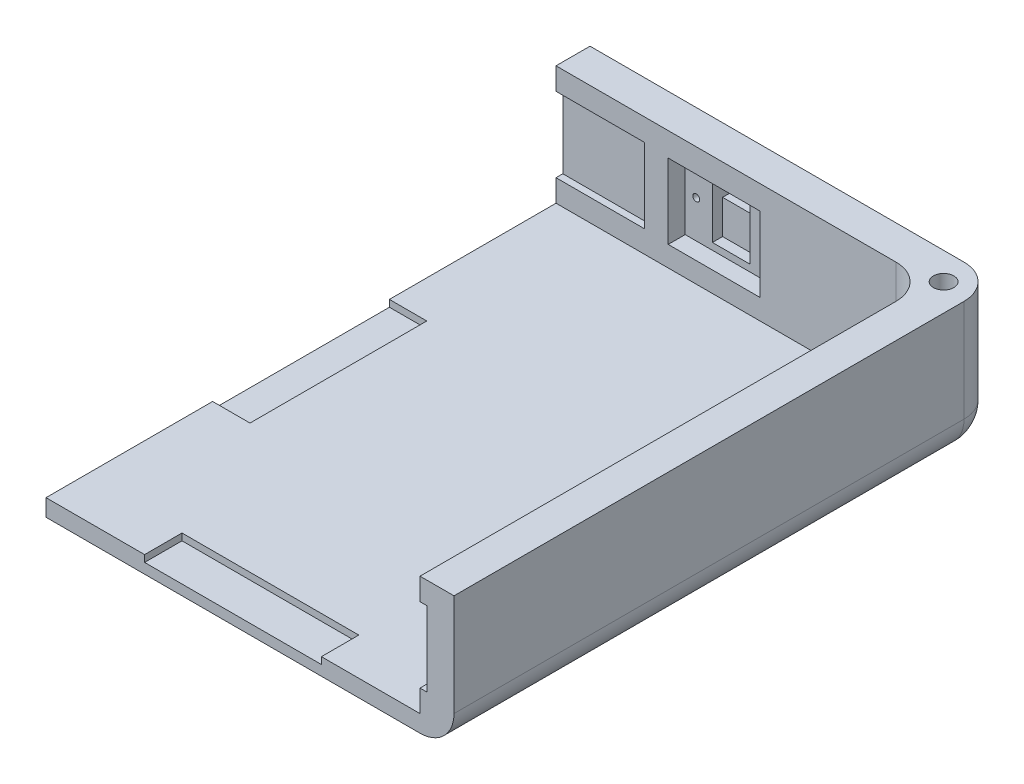
from build123d import *

# Parameters (mm, degrees)
ESQUISSE1_W             = 120
ESQUISSE1_H             = 160
BOSS_EXTRU_1_DEPTH      = 40
CONG_1_R                = 10
CONG_2_R                = 10
ESQUISSE2_W             = 110
ESQUISSE2_H             = 150
ENL_V_MAT_EXTRU_1_DEPTH = 35
CONG_3_R                = 10
ESQUISSE3_R             = 3
ENL_V_MAT_EXTRU_2_DEPTH = 35
ESQUISSE4_R             = 2.5
BOSS_EXTRU_2_DEPTH      = 2.5
CONG_4_R                = 2.5
ESQUISSE5_W             = 11
ESQUISSE5_H             = 52
ESQUISSE5_W_2           = 52
ESQUISSE5_H_2           = 11
ENL_V_MAT_EXTRU_3_DEPTH = 2
ESQUISSE6_W             = 26
ESQUISSE6_H             = 22
ENL_V_MAT_EXTRU_4_DEPTH = 2
ESQUISSE7_W             = 26
ESQUISSE7_H             = 22
ENL_V_MAT_EXTRU_5_DEPTH = 2
ESQUISSE8_W             = 27
ESQUISSE8_H             = 22
ENL_V_MAT_EXTRU_6_DEPTH = 5
ESQUISSE9_R             = 1
ENL_V_MAT_EXTRU_7_DEPTH = 4
ESQUISSE10_W            = 11
ESQUISSE10_H            = 6
ENL_V_MAT_EXTRU_8_DEPTH = 201.062490237
ESQUISSE11_W            = 11
ESQUISSE11_H            = 10
ENL_V_MAT_EXTRU_9_DEPTH = 3


with BuildPart() as part:
    # Esquisse1 → Boss.-Extru.1 (new body)
    with BuildSketch(Plane(origin=(0, 0, 0), x_dir=(1, 0, 0), z_dir=(0, 1, 0))):
        with Locations((60, 80)):
            Rectangle(ESQUISSE1_W, ESQUISSE1_H)
    extrude(amount=BOSS_EXTRU_1_DEPTH)

    # Congé1
    cong_1_edges = [part.edges().sort_by_distance(p)[0] for p in [
        (60, 0, -160),
    ]]
    fillet(cong_1_edges, radius=CONG_1_R)

    # Congé2
    cong_2_edges = [part.edges().sort_by_distance(p)[0] for p in [
        (120, 2.928932188, -157.071067812),
        (120, 0, -75),
        (120, 25, -160),
    ]]
    fillet(cong_2_edges, radius=CONG_2_R)

    # Esquisse2 → Enlèv. mat.-Extru.1 (cut)
    with BuildSketch(Plane(origin=(0, 40, 0), x_dir=(1, 0, 0), z_dir=(0, 1, 0))):
        with Locations((55, 75)):
            Rectangle(ESQUISSE2_W, ESQUISSE2_H)
    extrude(amount=-ENL_V_MAT_EXTRU_1_DEPTH, mode=Mode.SUBTRACT)

    # Congé3
    cong_3_edges = [part.edges().sort_by_distance(p)[0] for p in [
        (110, 22.5, -150),
    ]]
    fillet(cong_3_edges, radius=CONG_3_R)

    # Esquisse3 → Enlèv. mat.-Extru.2 (cut)
    with BuildSketch(Plane(origin=(0, 40, 0), x_dir=(1, 0, 0), z_dir=(0, 1, 0))):
        with Locations(Location((112, 152, 0), (0, 0, 270))):
            Circle(ESQUISSE3_R)
    extrude(amount=-ENL_V_MAT_EXTRU_2_DEPTH, mode=Mode.SUBTRACT)

    # Esquisse4 → Boss.-Extru.2 (add)
    with BuildSketch(Plane.XZ):
        with Locations(Location((90, -130, 0), (0, 0, 270))):
            Circle(ESQUISSE4_R)
    extrude(amount=BOSS_EXTRU_2_DEPTH)

    # Congé4
    cong_4_edges = [part.edges().sort_by_distance(p)[0] for p in [
        (90, -2.5, -127.5),
    ]]
    fillet(cong_4_edges, radius=CONG_4_R - 0.0001)  # a hair under: the kernel refuses the full size

    # Esquisse5 → Enlèv. mat.-Extru.3 (cut)
    with BuildSketch(Plane(origin=(0, 5, 0), x_dir=(1, 0, 0), z_dir=(0, 1, 0))):
        with Locations((5.5, 75)):
            Rectangle(ESQUISSE5_W, ESQUISSE5_H)
        with Locations((55, 5.5)):
            Rectangle(ESQUISSE5_W_2, ESQUISSE5_H_2)
    extrude(amount=-ENL_V_MAT_EXTRU_3_DEPTH, mode=Mode.SUBTRACT)

    # Esquisse6 → Enlèv. mat.-Extru.4 (cut)
    with BuildSketch(Plane.XY.offset(-150)):
        with Locations((13, 22.5)):
            Rectangle(ESQUISSE6_W, ESQUISSE6_H)
    extrude(amount=-ENL_V_MAT_EXTRU_4_DEPTH, mode=Mode.SUBTRACT)

    # Esquisse7 → Enlèv. mat.-Extru.5 (cut)
    with BuildSketch(Plane.ZY.offset(-110)):
        with Locations((-13, 22.5)):
            Rectangle(ESQUISSE7_W, ESQUISSE7_H)
    extrude(amount=-ENL_V_MAT_EXTRU_5_DEPTH, mode=Mode.SUBTRACT)

    # Esquisse8 → Enlèv. mat.-Extru.6 (cut)
    with BuildSketch(Plane.XY.offset(-150)):
        with Locations((46.5, 22)):
            Rectangle(ESQUISSE8_W, ESQUISSE8_H)
    extrude(amount=-ENL_V_MAT_EXTRU_6_DEPTH, mode=Mode.SUBTRACT)

    # Esquisse9 → Enlèv. mat.-Extru.7 (cut)
    with BuildSketch(Plane.XY.offset(-155)):
        with Locations((56.75, 22)):
            Circle(ESQUISSE9_R)
        with Locations((36.25, 22)):
            Circle(ESQUISSE9_R)
    extrude(amount=-ENL_V_MAT_EXTRU_7_DEPTH, mode=Mode.SUBTRACT)

    # Esquisse10 → Enlèv. mat.-Extru.8 (cut, through all)
    with BuildSketch(Plane.XY.offset(-155)):
        with Locations((46.5, 26)):
            Rectangle(ESQUISSE10_W, ESQUISSE10_H)
    extrude(amount=-ENL_V_MAT_EXTRU_8_DEPTH, mode=Mode.SUBTRACT)

    # Esquisse11 → Enlèv. mat.-Extru.9 (cut)
    with BuildSketch(Plane.XY.offset(-155)):
        with Locations((46.5, 18)):
            Rectangle(ESQUISSE11_W, ESQUISSE11_H)
    extrude(amount=-ENL_V_MAT_EXTRU_9_DEPTH, mode=Mode.SUBTRACT)


solid = part.part
